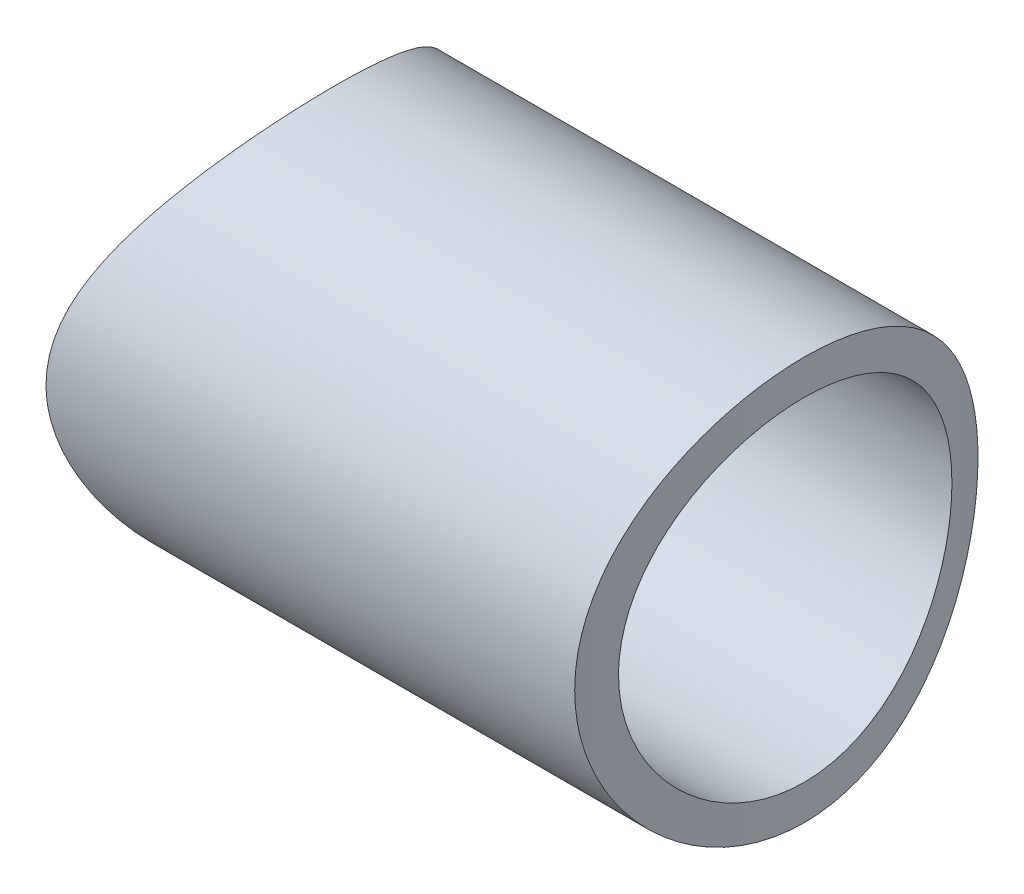
from build123d import *

# Parameters (mm, degrees)
SKETCH1_R                = 42.725
SKETCH1_R_2              = 15.875
BOSS_EXTRUDE1_DEPTH      = 1
SKETCH2_R                = 42.725
SKETCH2_R_2              = 41.725
SKETCH2_R_3              = 16.875
SKETCH2_R_4              = 15.875
BOSS_EXTRUDE2_DEPTH      = 25
SKETCH3_R                = 9.53
CUT_EXTRUDE1_DEPTH       = 66.778805477
BOSS_EXTRUDE3_REACH      = 67.779
BOSS_EXTRUDE3_END_RADIUS = 42.725
SKETCH9_R                = 11.53
SKETCH9_R_2              = 9.53
CUT_EXTRUDE2_DEPTH       = 66.990091471
CUT_EXTRUDE2_DEPTH_BACK  = 66.990091471
CUT_EXTRUDE4_DEPTH       = 53.449977529
CUT_EXTRUDE4_DEPTH_BACK  = 53.449977529
SKETCH11_R               = 50
SKETCH11_R_2             = 11.53


with BuildPart() as part:
    # Sketch1 → Boss-Extrude1 (new body)
    with BuildSketch(Plane(origin=(0, 0, 0), x_dir=(1, 0, 0), z_dir=(0, 1, 0))):
        Circle(SKETCH1_R)
        Circle(SKETCH1_R_2, mode=Mode.SUBTRACT)
    extrude(amount=BOSS_EXTRUDE1_DEPTH)

    # Sketch2 → Boss-Extrude2 (add)
    # profile 1 of 2: a face of its own
    with BuildSketch(Plane(origin=(0, 1, 0), x_dir=(1, 0, 0), z_dir=(0, 1, 0))):
        Circle(SKETCH2_R)
        Circle(SKETCH2_R_2, mode=Mode.SUBTRACT)
    # profile 2 of 2: a face of its own
    with BuildSketch(Plane(origin=(0, 1, 0), x_dir=(1, 0, 0), z_dir=(0, 1, 0))):
        Circle(SKETCH2_R_3)
        Circle(SKETCH2_R_4, mode=Mode.SUBTRACT)
    extrude(amount=BOSS_EXTRUDE2_DEPTH)

    # Sketch3 → Cut-Extrude1 (cut, through all)
    with BuildSketch(Plane(origin=(0, 0, 0), x_dir=(0, 0, -1), z_dir=(1, 0, 0))):
        with Locations((0, 11)):
            Circle(SKETCH3_R)
    extrude(amount=CUT_EXTRUDE1_DEPTH, mode=Mode.SUBTRACT)

    # Boss-Extrude3: up to this cylinder (the profile starts inside it)
    boss_extrude3_end = Plane(origin=(0, 11, 0), z_dir=(0, -1, 0)) * Cylinder(BOSS_EXTRUDE3_END_RADIUS, 222.008, mode=Mode.PRIVATE)
    # Sketch9 → Boss-Extrude3 (add, up to the surface)
    with BuildSketch(Plane(origin=(0, 0, 0), x_dir=(0, 0, -1), z_dir=(1, 0, 0)), mode=Mode.PRIVATE) as boss_extrude3_sk1:
        with Locations((0, 11)):
            Circle(SKETCH9_R)
        with Locations((0, 11)):
            Circle(SKETCH9_R_2, mode=Mode.SUBTRACT)
    boss_extrude3_tool1 = extrude(boss_extrude3_sk1.sketch, amount=BOSS_EXTRUDE3_REACH, mode=Mode.PRIVATE) & boss_extrude3_end
    add(boss_extrude3_tool1.solids().sort_by_distance((0, 11, 11.203882))[0])

    # Sketch10 → Cut-Extrude2 (cut, two sides: drawn at the far end of the back side and taken through both)
    with BuildSketch(Plane(origin=(0, 26, 0), x_dir=(1, 0, 0), z_dir=(0, 1, 0)).offset(-CUT_EXTRUDE2_DEPTH_BACK)):
        with BuildLine():
            ThreePointArc((1.562409729, -15.797927106), (15.875, 0), (1.562409729, 15.797927106))
            Line((1.562409729, 15.797927106), (41.036063238, 11.893995921))
            ThreePointArc((41.036063238, 11.893995921), (-42.725, 0), (41.036063238, -11.893995921))
            Line((41.036063238, -11.893995921), (1.562409729, -15.797927106))
        make_face()
    extrude(amount=CUT_EXTRUDE2_DEPTH + CUT_EXTRUDE2_DEPTH_BACK, mode=Mode.SUBTRACT)

    # Sketch11 → Cut-Extrude4 (cut, two sides: drawn at the far end of the back side and taken through both)
    with BuildSketch(Plane(origin=(0, 0, 0), x_dir=(0, 0, -1), z_dir=(1, 0, 0)).offset(-CUT_EXTRUDE4_DEPTH_BACK)):
        with Locations((0, 11)):
            Circle(SKETCH11_R)
        with Locations((0, 11)):
            Circle(SKETCH11_R_2, mode=Mode.SUBTRACT)
    extrude(amount=CUT_EXTRUDE4_DEPTH + CUT_EXTRUDE4_DEPTH_BACK, mode=Mode.SUBTRACT)


solid = part.part
